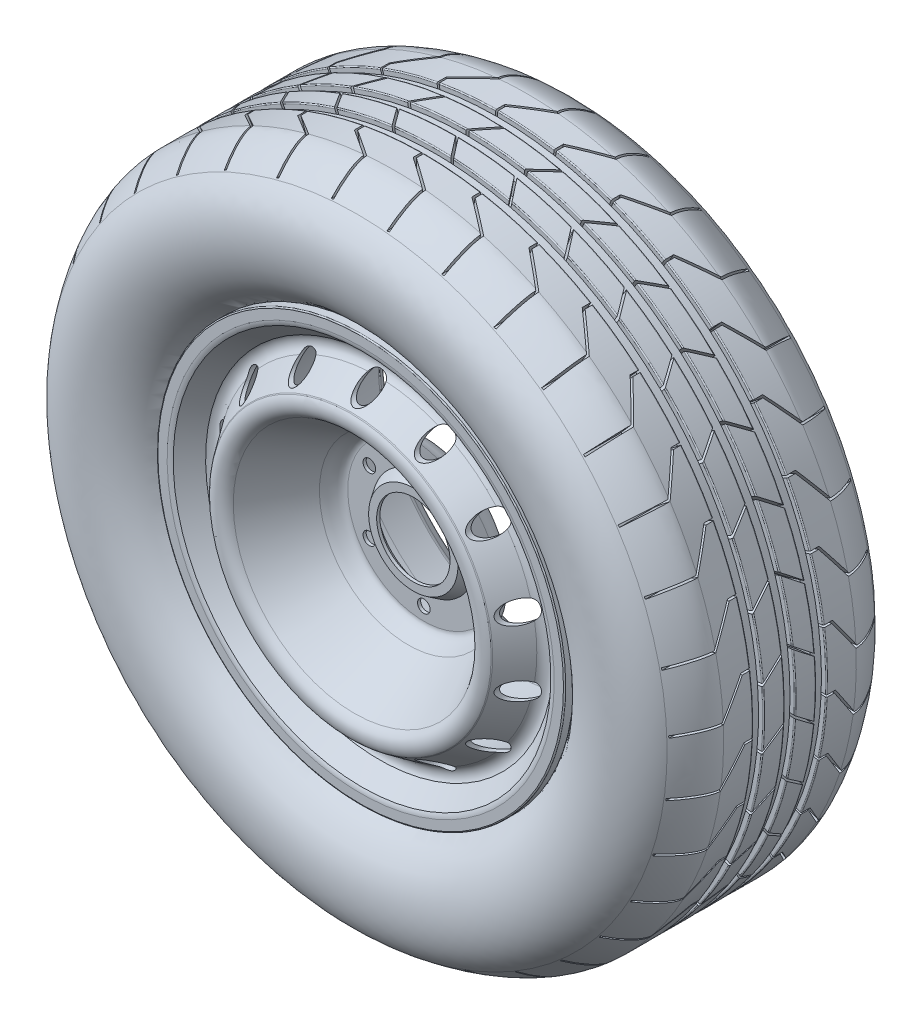
from build123d import *

# Parameters (mm, degrees)
SKETCH4_R          = 10
CUT_EXTRUDE1_DEPTH = 280
SKETCH5_R          = 6
CUT_EXTRUDE2_DEPTH = 308.751546457
SKETCH8_W          = 10
SKETCH8_H          = 5
FILLET1_R          = 1
CUT_EXTRUDE3_DEPTH = 25
CIRPATTERN1_COUNT  = 35


with BuildPart() as part:
    # Sketch3 → Revolve2 (revolve)
    with BuildSketch(Plane(origin=(0, 0, 0), x_dir=(0, 0, -1), z_dir=(1, 0, 0))):
        with BuildLine():
            Line((-205.976672895, 132.545710763), (-168.32873816, 158.905030976))
            Line((-168.32873816, 158.905030976), (-50.533527528, 160.605115441))
            Line((-50.533527528, 160.605115441), (-19.67682352, 162.242109346))
            ThreePointArc((-19.67682352, 162.242109346), (-17.988866809, 162.681997), (-16.502942556, 163.595631567))
            Line((-16.502942556, 163.595631567), (-8.613282192, 169.732034072))
            ThreePointArc((-8.613282192, 169.732034072), (-7.23504651, 171.163590491), (-6.367288364, 172.951293815))
            Line((-6.367288364, 172.951293815), (-3.257166694, 181.724352935))
            ThreePointArc((-3.257166694, 181.724352935), (-2.62535832, 183.407484304), (-2.478866017, 185.199313826))
            Line((-2.478866017, 185.199313826), (-2.478866017, 190.02316213))
            ThreePointArc((-2.478866017, 190.02316213), (-3.464560288, 194.56121075), (-8.002608909, 193.575516479))
            Line((-8.002608909, 193.575516479), (-15.84871123, 193.575516479))
            ThreePointArc((-15.84871123, 193.575516479), (-16.347620773, 193.357623724), (-16.565513529, 192.85871418))
            Line((-16.565513529, 192.85871418), (-16.565513529, 188.096364254))
            ThreePointArc((-16.565513529, 188.096364254), (-16.672768644, 187.147180592), (-17.066683828, 186.276959866))
            Line((-17.066683828, 186.276959866), (-21.032277405, 177.690694143))
            ThreePointArc((-21.032277405, 177.690694143), (-21.913333431, 176.327612765), (-23.041277725, 175.160568535))
            Line((-23.041277725, 175.160568535), (-29.905978286, 169.821356987))
            ThreePointArc((-29.905978286, 169.821356987), (-31.406523464, 168.93888179), (-33.134571829, 168.728531716))
            Line((-33.134571829, 168.728531716), (-60.542176562, 168.728531716))
            Line((-60.542176562, 168.728531716), (-164.636430634, 169.644050138))
            ThreePointArc((-164.636430634, 169.644050138), (-171.313601612, 170.559422201), (-177.229613663, 173.787938839))
            Line((-177.229613663, 173.787938839), (-180.613912, 175.971696747))
            Line((-180.613912, 175.971696747), (-187.299183614, 184.567045965))
            ThreePointArc((-187.299183614, 184.567045965), (-188.500602287, 186.514981874), (-188.97748407, 188.753384183))
            Line((-188.97748407, 188.753384183), (-188.97748407, 193.511188152))
            ThreePointArc((-188.97748407, 193.511188152), (-189.293281495, 194.175237477), (-189.95733082, 194.491034901))
            Line((-189.95733082, 194.491034901), (-197.443763886, 194.491034901))
            ThreePointArc((-197.443763886, 194.491034901), (-198.190119131, 194.145301882), (-198.53585215, 193.398946637))
            Line((-198.53585215, 193.398946637), (-198.53585215, 184.567045965))
            ThreePointArc((-198.53585215, 184.567045965), (-198.147923782, 182.240346175), (-197.247657756, 180.060084398))
            Line((-197.247657756, 180.060084398), (-180.613912, 165.772511518))
            ThreePointArc((-180.613912, 165.772511518), (-178.993638023, 158.574272361), (-182.937855027, 152.338641924))
            Line((-182.937855027, 152.338641924), (-207.697312521, 135.00322969))
            Line((-207.697312521, 135.00322969), (-208.408674764, 134.302232015))
            ThreePointArc((-208.408674764, 134.302232015), (-210.599766045, 124.053775031), (-204.517883943, 115.518995499))
            Line((-204.517883943, 115.518995499), (-153.01247642, 84.869794829))
            add(Edge.make_bspline(
                [(-153.01247642, 84.869794829), (-151.064119062, 83.710390438), (-144.265476161, 80.542437664), (-138.325, 76.29074716), (-138.325, 72.5)],
                knots=[0, 0, 0, 0, 0.479312715, 1, 1, 1, 1], degree=3))
            Line((-138.325, 72.5), (-138.325, 49.128999377))
            Line((-138.325, 49.128999377), (-148.325, 42.635891688))
            Line((-148.325, 42.635891688), (-148.325, 35))
            Line((-148.325, 35), (-145.325, 35))
            Line((-145.325, 35), (-145.325, 41.006892311))
            Line((-145.325, 41.006892311), (-135.325, 47.5))
            Line((-135.325, 47.5), (-135.325, 72.5))
            add(Edge.make_bspline(
                [(-154.188885966, 89.060819209), (-147.180223198, 84.890190882), (-141.057590791, 83.97066154), (-135.325, 76.308231088), (-135.325, 72.5)],
                knots=[0, 0, 0, 0, 0.64050498, 1, 1, 1, 1], degree=3))
            Line((-154.188885966, 89.060819209), (-202.98375688, 118.097067288))
            ThreePointArc((-202.98375688, 118.097067288), (-207.662127727, 124.662282313), (-205.976672895, 132.545710763))
        make_face()
    revolve(axis=Axis((0, 0, -0.000166179), (0, 0, 1)))

    # Sketch4 → Cut-Extrude1 (cut)
    with BuildSketch(Plane.XY.offset(258.53585215)):
        with Locations((0, 147)):
            Circle(SKETCH4_R)
        with Locations((63.78090965, 132.442423582)):
            Circle(SKETCH4_R)
        with Locations((114.929227923, 91.653000873)):
            Circle(SKETCH4_R)
        with Locations((143.314403091, 32.710577292)):
            Circle(SKETCH4_R)
        with Locations((143.314403091, -32.710577292)):
            Circle(SKETCH4_R)
        with Locations((114.929227923, -91.653000873)):
            Circle(SKETCH4_R)
        with Locations((63.78090965, -132.442423582)):
            Circle(SKETCH4_R)
        with Locations((0, -147)):
            Circle(SKETCH4_R)
        with Locations((-63.78090965, -132.442423582)):
            Circle(SKETCH4_R)
        with Locations((-114.929227923, -91.653000873)):
            Circle(SKETCH4_R)
        with Locations((-143.314403091, -32.710577292)):
            Circle(SKETCH4_R)
        with Locations((-143.314403091, 32.710577292)):
            Circle(SKETCH4_R)
        with Locations((-114.929227923, 91.653000873)):
            Circle(SKETCH4_R)
        with Locations((-63.78090965, 132.442423582)):
            Circle(SKETCH4_R)
    extrude(amount=-CUT_EXTRUDE1_DEPTH, mode=Mode.SUBTRACT)

    # Sketch5 → Cut-Extrude2 (cut, through all)
    with BuildSketch(Plane.XY.offset(138.325)):
        with Locations((0, 60)):
            Circle(SKETCH5_R)
        with Locations((51.961524227, 30)):
            Circle(SKETCH5_R)
        with Locations((51.961524227, -30)):
            Circle(SKETCH5_R)
        with Locations((0, -60)):
            Circle(SKETCH5_R)
        with Locations((-51.961524227, -30)):
            Circle(SKETCH5_R)
        with Locations((-51.961524227, 30)):
            Circle(SKETCH5_R)
    extrude(amount=-CUT_EXTRUDE2_DEPTH, mode=Mode.SUBTRACT)


with BuildPart() as body_2:
    # Sketch2 → Revolve3 (revolve)
    with BuildSketch(Plane(origin=(0, 0, 0), x_dir=(0, 0, -1), z_dir=(1, 0, 0))):
        with BuildLine():
            Line((-187, 186.5), (-172.410491082, 186.5))
            add(Edge.make_bspline(
                [(-194.359104699, 205.293895621), (-184.626225491, 203.680301423), (-171.070311407, 198.87547333), (-172.410491082, 186.5)],
                knots=[0, 0, 0, 0, 1, 1, 1, 1], degree=3))
            add(Edge.make_bspline(
                [(-102.87, 293.979526917), (-122.20862008, 293.979526917), (-146.808097308, 294.425225907), (-182.441022796, 290.361808714), (-213.553174942, 285.006701479), (-215.346225975, 259.172854777), (-214.359453345, 234.088416886), (-206.251754181, 212.706015592), (-194.359104699, 205.293895621)],
                knots=[0, 0, 0, 0, 0.276163159, 0.412599443, 0.589197595, 0.675863109, 0.783624344, 1, 1, 1, 1], degree=3))
            add(Edge.make_bspline(
                [(-102.87, 293.979526917), (-83.53137992, 293.979526917), (-58.931902692, 294.425225907), (-23.298977204, 290.361808714), (7.813174942, 285.006701479), (9.606225975, 259.172854777), (8.619453345, 234.088416886), (0.511754181, 212.706015592), (-11.380895301, 205.293895621)],
                knots=[0, 0, 0, 0, 0.276163159, 0.412599443, 0.589197595, 0.675863109, 0.783624344, 1, 1, 1, 1], degree=3))
            add(Edge.make_bspline(
                [(-11.380895301, 205.293895621), (-21.113774509, 203.680301423), (-34.669688593, 198.87547333), (-33.329508918, 186.5)],
                knots=[0, 0, 0, 0, 1, 1, 1, 1], degree=3))
            Line((-33.329508918, 186.5), (-18.74, 186.5))
            ThreePointArc((-18.74, 186.5), (-17.39206834, 187.119668546), (-16.841841123, 188.497405413))
            Line((-16.841841123, 188.497405413), (-16.841841123, 190.371286075))
            add(Edge.make_bspline(
                [(-16.841841123, 190.371286075), (-18.325078041, 194.651509706), (-11.218994202, 198.657808081), (18.038375738, 223.395196091), (23.581961715, 273.787913986), (-3.823701149, 295.563942392)],
                knots=[0, 0, 0, 0, 0.092593937, 0.175690741, 1, 1, 1, 1], degree=3))
            add(Edge.make_bspline(
                [(-3.823701149, 295.563942392), (-11.054342518, 301.602837614), (-28.724371157, 313.69), (-39.634002918, 313.69)],
                knots=[0, 0, 0, 0, 1, 1, 1, 1], degree=3))
            Line((-39.634002918, 313.69), (-166.105997082, 313.69))
            add(Edge.make_bspline(
                [(-201.916298851, 295.563942392), (-194.685657482, 301.602837614), (-177.015628843, 313.69), (-166.105997082, 313.69)],
                knots=[0, 0, 0, 0, 1, 1, 1, 1], degree=3))
            add(Edge.make_bspline(
                [(-188.898158877, 190.371286075), (-187.414921959, 194.651509706), (-194.521005798, 198.657808081), (-223.778375738, 223.395196091), (-229.321961715, 273.787913986), (-201.916298851, 295.563942392)],
                knots=[0, 0, 0, 0, 0.092593937, 0.175690741, 1, 1, 1, 1], degree=3))
            Line((-188.898158877, 190.371286075), (-188.898158877, 188.497405413))
            ThreePointArc((-188.898158877, 188.497405413), (-188.34793166, 187.119668546), (-187, 186.5))
        make_face()
    revolve(axis=Axis((0, 0, -0.000166179), (0, 0, 1)))

    # Sketch8 → Cut-Revolve1 (revolve, cut)
    with BuildSketch(Plane(origin=(0, 0, 0), x_dir=(0, 0, -1), z_dir=(1, 0, 0))):
        with Locations((-132.87, 311.19)):
            Rectangle(SKETCH8_W, SKETCH8_H)
        with Locations((-102.87, 311.19)):
            Rectangle(SKETCH8_W, SKETCH8_H)
        with Locations((-72.87, 311.19)):
            Rectangle(SKETCH8_W, SKETCH8_H)
    revolve(axis=Axis((0, 0, 168.32873816), (0, 0, 1)), mode=Mode.SUBTRACT)

    # Fillet1
    fillet1_edges = [body_2.edges().sort_by_distance(p)[0] for p in [
        (0, -313.69, 137.87),
        (0, -313.69, 127.87),
        (0, -313.69, 107.87),
        (0, -313.69, 97.87),
        (0, -313.69, 77.87),
        (0, -313.69, 67.87),
    ]]
    fillet(fillet1_edges, radius=FILLET1_R)

    # Sketch9 → Cut-Extrude3 (cut)
    with BuildSketch(Plane(origin=(0, 320, 0), x_dir=(1, 0, 0), z_dir=(0, 1, 0))):
        Polygon((0, -137.87), (0, -145.446335925), (29.59153403, -166.105997082), (29.59153403, -220.629597864), (27.59153403, -220.629597864), (27.59153403, -167.148878694), (-2, -146.489217536), (-2, -137.87), align=None)
        Polygon((-2, -67.87), (0, -67.87), (0, -60.293664075), (29.59153403, -39.634002918), (29.59153403, 14.889597864), (27.59153403, 14.889597864), (27.59153403, -38.591121306), (-2, -59.250782464), align=None)
        Polygon((0, -107.87), (15.388959689, -127.87), (17.912489122, -127.87), (2.523529434, -107.87), align=None)
        Polygon((15.388959689, -77.87), (17.912489122, -77.87), (2.523529434, -97.87), (0, -97.87), align=None)
    cut_extrude3 = extrude(amount=-CUT_EXTRUDE3_DEPTH, mode=Mode.SUBTRACT)

    # CirPattern1: Cut-Extrude3 ×35 about axis
    cirpattern1_axis = Axis((0, 0, 168.32873816), (0, 0, 1))
    for i in range(1, CIRPATTERN1_COUNT):
        add(cut_extrude3.rotate(cirpattern1_axis, i * 360 / CIRPATTERN1_COUNT), mode=Mode.SUBTRACT)


solid = Compound([part.part, body_2.part])
